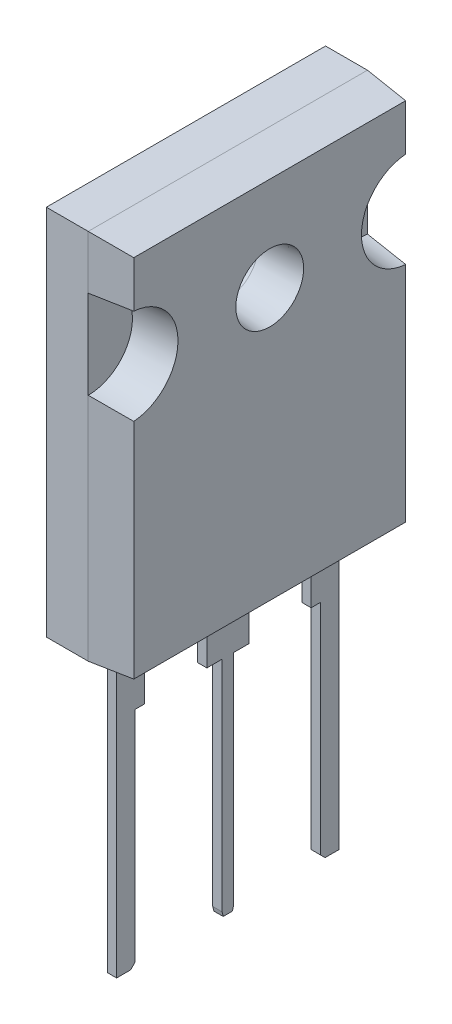
from build123d import *

# Parameters (mm, degrees)
EXTRUDE1_DEPTH     = 2.286
EXTRUDE1_DRAFT     = 5
SKETCH6_W          = 15.24
SKETCH6_H          = 20.32
EXTRUDE2_DEPTH     = 2.286
SKETCH7_R          = 1.651
CUT_EXTRUDE3_DEPTH = 18.42262265
SKETCH9_R          = 1.651
CUT_EXTRUDE6_DEPTH = 2.286
CUT_EXTRUDE6_DRAFT = -5
SKETCH10_W         = 0.508
SKETCH10_H         = 15.748
BASE_FLANGE1_DEPTH = 1.143
CUT_EXTRUDE8_DEPTH = 32.746951854
EXTRUDE3_DEPTH     = 0.508


# Sheet-metal steps are written as plain solids
with BuildPart() as part:
    # Sketch2 → Extrude1 (with draft: the straight prism first)
    with BuildSketch(Plane(origin=(0, 0, 0), x_dir=(0, 0, -1), z_dir=(1, 0, 0))):
        with BuildLine():
            ThreePointArc((7.62, -2.413), (5.207, 0), (7.62, 2.413))
            Line((7.62, 2.413), (7.62, 5.334))
            Line((7.62, 5.334), (-7.62, 5.334))
            Line((-7.62, 5.334), (-7.62, 2.413))
            ThreePointArc((-7.62, 2.413), (-5.207, 0), (-7.62, -2.413))
            Line((-7.62, -2.413), (-7.62, -14.986))
            Line((-7.62, -14.986), (7.62, -14.986))
            Line((7.62, -14.986), (7.62, -2.413))
        make_face()
    extrude(amount=EXTRUDE1_DEPTH)
    # Extrude1: the draft: its side faces are tilted about the plane it starts from
    extrude1_sides = [part.faces().sort_by_distance(p)[0] for p in [
        (1.143, 0, -5.207),
        (1.143, 3.8735, -7.62),
        (1.143, 5.334, 0),
        (1.143, 3.8735, 7.62),
        (1.143, 0, 5.207),
        (1.143, -8.6995, 7.62),
        (1.143, -14.986, 0),
        (1.143, -8.6995, -7.62),
    ]]
    draft(extrude1_sides, Plane(origin=(0, 0, 0), x_dir=(0, 0, -1), z_dir=(1, 0, 0)), EXTRUDE1_DRAFT)

    # Sketch6 → Extrude2 (add)
    with BuildSketch(Plane.ZY):
        with Locations((0, -4.826)):
            Rectangle(SKETCH6_W, SKETCH6_H)
    extrude(amount=EXTRUDE2_DEPTH)

    # Sketch7 → Cut-Extrude3 (cut, through all)
    with BuildSketch(Plane(origin=(2.286, 0, 0), x_dir=(0, 0, -1), z_dir=(1, 0, 0))):
        Circle(SKETCH7_R)
    extrude(amount=-CUT_EXTRUDE3_DEPTH, mode=Mode.SUBTRACT)


with BuildPart() as cut_extrude6_tool:
    # Sketch9 → Cut-Extrude6 (with draft: the straight prism first)
    with BuildSketch(Plane(origin=(0, 0, 0), x_dir=(0, 0, -1), z_dir=(1, 0, 0))):
        Circle(SKETCH9_R)
    extrude(amount=CUT_EXTRUDE6_DEPTH)
    # Cut-Extrude6: the draft: its side faces are tilted about the plane it starts from
    cut_extrude6_sides = [cut_extrude6_tool.faces().sort_by_distance(p)[0] for p in [
        (1.143, 0, 1.651),
    ]]
    draft(cut_extrude6_sides, Plane(origin=(0, 0, 0), x_dir=(0, 0, -1), z_dir=(1, 0, 0)), CUT_EXTRUDE6_DRAFT)


with BuildPart() as part_1:
    add(part.part)

    # Cut-Extrude6: cut by cut_extrude6_tool
    add(cut_extrude6_tool.part, mode=Mode.SUBTRACT)

    # Sketch15 → Extrude3 (add)
    with BuildSketch(Plane(origin=(0, 0, 0), x_dir=(0, 0, -1), z_dir=(1, 0, 0))):
        Polygon((-6.0706, -14.986), (-4.5466, -14.986), (-4.5466, -18.542), (-5.0546, -18.542), (-5.0546, -30.48), (-5.3086, -30.734), (-6.0706, -30.734), align=None)
        Polygon((5.0546, -30.48), (5.0546, -18.542), (4.5466, -18.542), (4.5466, -14.986), (6.0706, -14.986), (6.0706, -30.734), (5.3086, -30.734), align=None)
    extrude(amount=-EXTRUDE3_DEPTH)


with BuildPart() as body_2:
    # Sketch10 → Base-Flange1 (new, symmetric)
    with BuildSketch(Plane.XY):
        with Locations((-0.254, -22.86)):
            Rectangle(SKETCH10_W, SKETCH10_H)
    extrude(amount=BASE_FLANGE1_DEPTH, both=True)

    # Sketch13 → Cut-Extrude8 (cut, through all)
    with BuildSketch(Plane(origin=(0, 0, 0), x_dir=(0, 0, -1), z_dir=(1, 0, 0))):
        Polygon((-1.143, -30.734), (-0.254, -30.734), (-0.3175, -30.48), (-0.3175, -18.542), (-1.143, -18.542), align=None)
        Polygon((0.254, -30.734), (0.3175, -30.48), (0.3175, -18.542), (1.143, -18.542), (1.143, -30.734), align=None)
    extrude(amount=-CUT_EXTRUDE8_DEPTH, mode=Mode.SUBTRACT)


solid = Compound([part_1.part, body_2.part])
